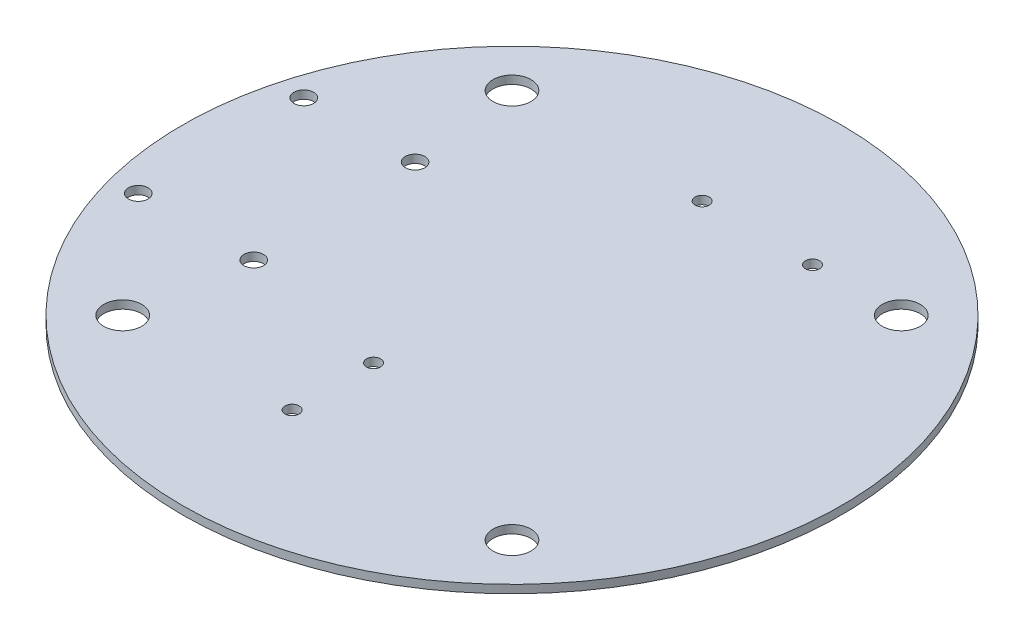
from build123d import *

# Parameters (mm, degrees)
SKETCH1_R            = 60.7
BOSS_EXTRUDE1_DEPTH  = 1.5
M6_CLEARANCE_HOLE1_D = 7
CIRPATTERN1_COUNT    = 4
M2_CLEARANCE_HOLE1_D = 2.6
M3_CLEARANCE_HOLE2_D = 3.6


with BuildPart() as part:
    # Sketch1 → Boss-Extrude1 (new body)
    with BuildSketch(Plane(origin=(0, 0, 0), x_dir=(1, 0, 0), z_dir=(0, 1, 0))):
        Circle(SKETCH1_R)
    extrude(amount=BOSS_EXTRUDE1_DEPTH)

    # M6 Clearance Hole1 (through all)
    with Locations(Plane(origin=(0, 1.5, 0), x_dir=(1, 0, 0), z_dir=(0, 1, 0))):
        with Locations((-35.850313806, -35.850313806)):
            m6_clearance_hole1 = Hole(M6_CLEARANCE_HOLE1_D / 2)

    # CirPattern1: M6 Clearance Hole1 ×4 about axis
    cirpattern1_axis = Axis((0, 1.5, 0), (0, -1, 0))
    for i in range(1, CIRPATTERN1_COUNT):
        add(m6_clearance_hole1.rotate(cirpattern1_axis, i * 360 / CIRPATTERN1_COUNT), mode=Mode.SUBTRACT)

    # M2 Clearance Hole1 (through all)
    with Locations(Plane(origin=(0, 1.5, 0), x_dir=(1, 0, 0), z_dir=(0, 1, 0))):
        with Locations((-0.709999951, 35.730000111), (19.610000128, 35.730000136), (-5.154, -20.350313806), (-5.154, -35.350313806)):
            Hole(M2_CLEARANCE_HOLE1_D / 2)

    # M3 Clearance Hole2 (through all)
    with Locations(Plane(origin=(0, 1.5, 0), x_dir=(1, 0, 0), z_dir=(0, 1, 0))):
        with Locations((-53.86454119, 15.511690642), (-53.864546519, -14.968309358), (-32.604546519, -14.968313075), (-33.36654119, 15.511687058)):
            Hole(M3_CLEARANCE_HOLE2_D / 2)


solid = part.part
